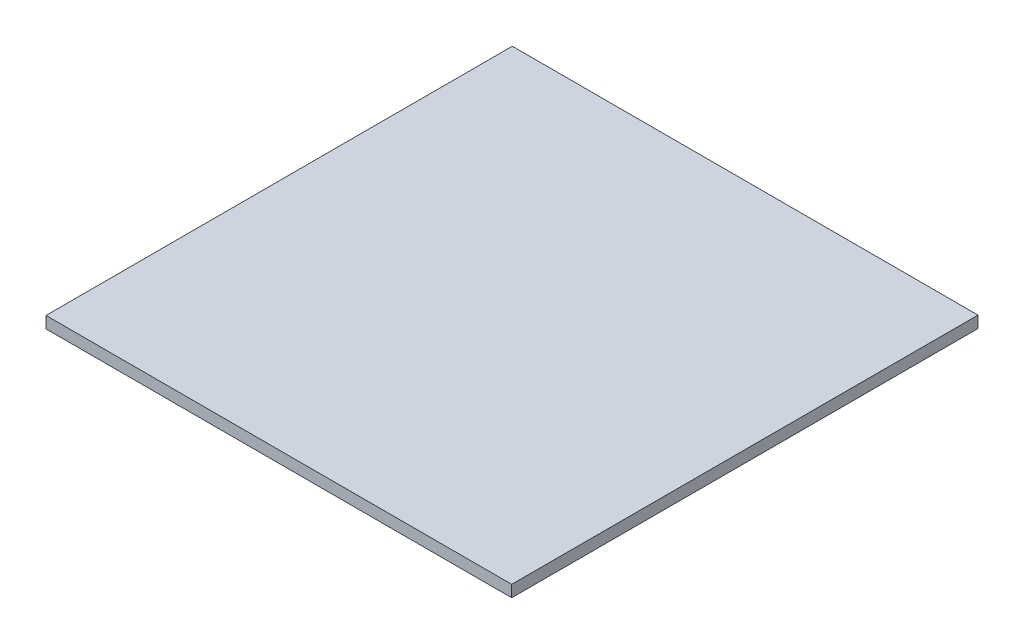
from build123d import *

# Parameters (mm, degrees)
SKETCH_1_W      = 199.74066423
SKETCH_1_H      = 200
EXTRUDE_1_DEPTH = 5


with BuildPart() as part:
    # Эскиз1 → Бобышка-Вытянуть1 (new body)
    with BuildSketch(Plane(origin=(0, 0, 0), x_dir=(1, 0, 0), z_dir=(0, 1, 0))):
        with Locations((99.870332115, 100)):
            Rectangle(SKETCH_1_W, SKETCH_1_H)
    extrude(amount=EXTRUDE_1_DEPTH)


solid = part.part
